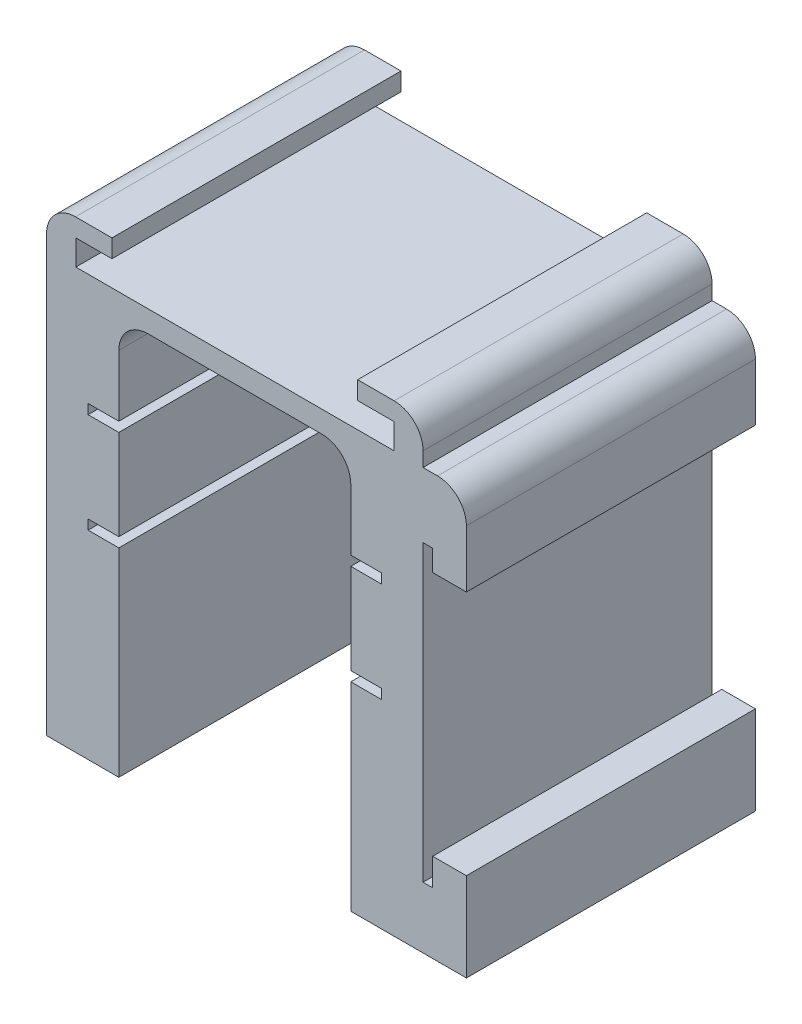
from build123d import *

# Parameters (mm, degrees)
BOSS_EXTRUDE1_DEPTH = 50.8
SKETCH2_R           = 2.6035
CUT_EXTRUDE1_DEPTH  = 5.08
FILLET1_R           = 5.08


with BuildPart() as part:
    # Sketch1 → Boss-Extrude1 (new body)
    with BuildSketch(Plane.XY):
        Polygon((12.7, 54.2036), (12.7, 70.0786), (53.467, 70.0786), (53.467, 54.2036), (58.8645, 54.2036), (58.8645, 52.5018), (53.467, 52.5018), (53.467, 36.6268), (58.8645, 36.6268), (58.8645, 34.925), (53.467, 34.925), (53.467, 0), (73.787, 0), (73.787, 15.572598677), (67.8688, 15.572598677), (67.8688, 10.7696), (66.167, 10.7696), (66.167, 62.4586), (67.8688, 62.4586), (67.8688, 58.752598677), (73.787, 58.752598677), (73.787, 73.8886), (66.167, 73.8886), (66.167, 81.5086), (54.6735, 81.5086), (54.6735, 78.3336), (61.0235, 78.3336), (61.0235, 73.8886), (5.1435, 73.8886), (5.1435, 78.3336), (11.4935, 78.3336), (11.4935, 81.5086), (0, 81.5086), (0, 0), (12.7, 0), (12.7, 34.925), (7.3025, 34.925), (7.3025, 36.6268), (12.7, 36.6268), (12.7, 52.5018), (7.3025, 52.5018), (7.3025, 54.2036), align=None)
    extrude(amount=BOSS_EXTRUDE1_DEPTH)

    # Sketch2 → Cut-Extrude1 (cut)
    with BuildSketch(Plane.XZ):
        with Locations((6.35, 44.45)):
            Circle(SKETCH2_R)
        with Locations((67.437, 6.35)):
            Circle(SKETCH2_R)
    extrude(amount=-CUT_EXTRUDE1_DEPTH, mode=Mode.SUBTRACT)

    # Fillet1
    fillet1_edges = [part.edges().sort_by_distance(p)[0] for p in [
        (73.787, 73.8886, 25.4),
        (66.167, 81.5086, 25.4),
        (0, 81.5086, 25.4),
        (53.467, 70.0786, 25.4),
        (12.7, 70.0786, 25.4),
    ]]
    fillet(fillet1_edges, radius=FILLET1_R)


solid = part.part
